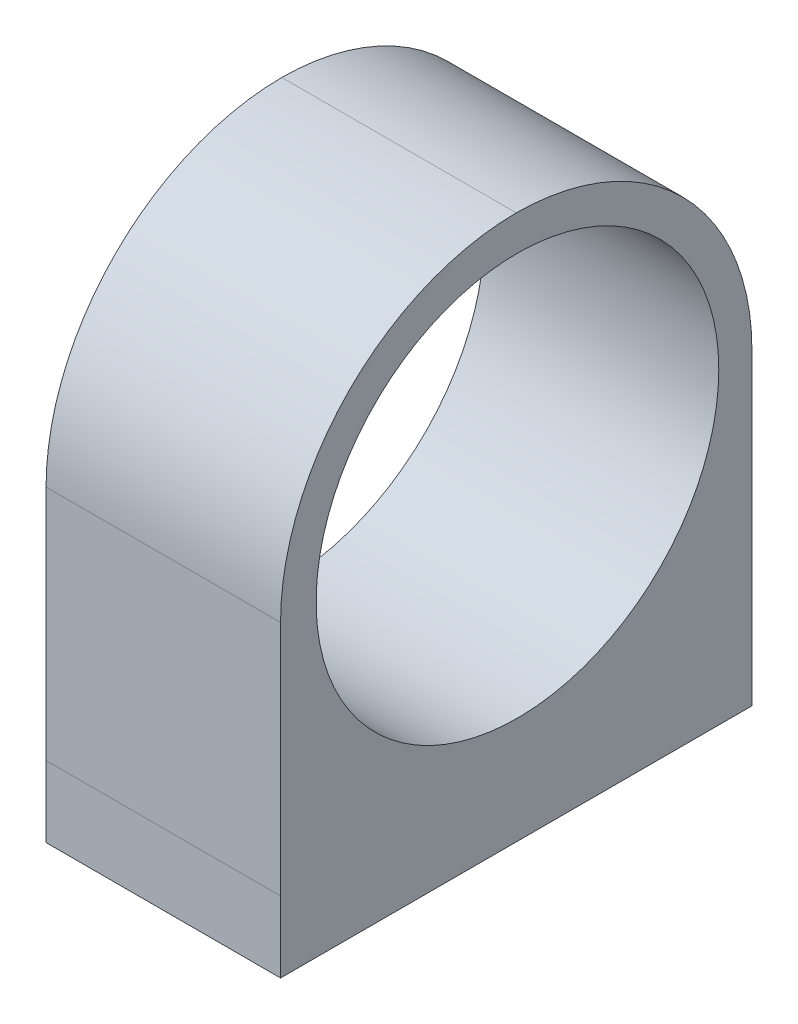
from build123d import *

# Parameters (mm, degrees)
SKETCH1_W           = 99
SKETCH1_H           = 199
BOSS_EXTRUDE1_DEPTH = 30
SKETCH2_W           = 99
SKETCH2_H           = 198.99569364
BOSS_EXTRUDE2_DEPTH = 200
FILLET1_R           = 100
SKETCH3_R           = 85
CUT_EXTRUDE1_DEPTH  = 99


with BuildPart() as part:
    # Sketch1 → Boss-Extrude1 (new body)
    with BuildSketch(Plane(origin=(0, 0, 0), x_dir=(1, 0, 0), z_dir=(0, 1, 0))):
        Rectangle(SKETCH1_W, SKETCH1_H)
    extrude(amount=BOSS_EXTRUDE1_DEPTH)

    # Sketch2 → Boss-Extrude2 (add)
    with BuildSketch(Plane(origin=(0, 30, 0), x_dir=(1, 0, 0), z_dir=(0, 1, 0))):
        Rectangle(SKETCH2_W, SKETCH2_H)
    extrude(amount=BOSS_EXTRUDE2_DEPTH)

    # Fillet1
    # the kernel refuses this fillet: 100 mm, written as the material it takes off along each edge
    with BuildSketch(Plane(origin=(-299.5, 230, -99.49784682), x_dir=(0, -1, 0), z_dir=(1, 0, 0)), Plane(origin=(299.5, 230, 99.49784682), x_dir=(0, -1, 0), z_dir=(-1, 0, 0))) as fillet1_piece_1:
        with BuildLine():
            CenterArc((FILLET1_R, -FILLET1_R), FILLET1_R, 90, 90)
            Line((0, -FILLET1_R), (0, 0))
            Line((0, 0), (FILLET1_R, 0))
        make_face()
    extrude(amount=599, mode=Mode.SUBTRACT)

    # Sketch3 → Cut-Extrude1 (cut)
    with BuildSketch(Plane(origin=(49.5, 0, 0), x_dir=(0, 0, -1), z_dir=(1, 0, 0))):
        with Locations((0.50215318, 130)):
            Circle(SKETCH3_R)
    extrude(amount=-CUT_EXTRUDE1_DEPTH, mode=Mode.SUBTRACT)


solid = part.part
